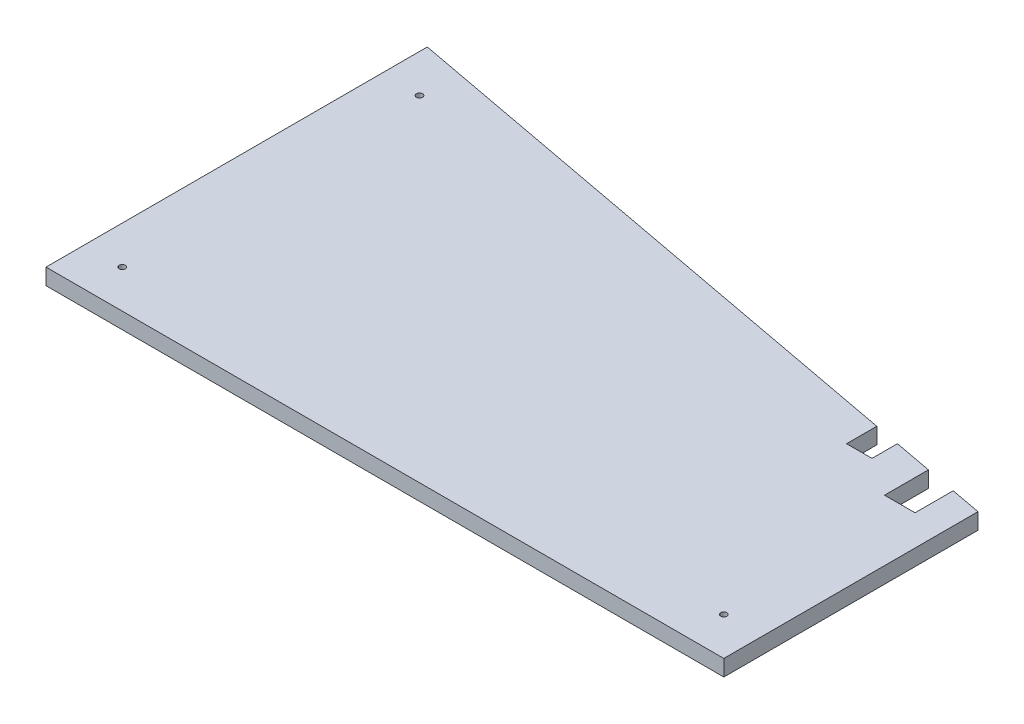
from build123d import *

# Parameters (mm, degrees)
BOSS_EXTRUDE1_DEPTH = 6.35
SKETCH3_R           = 1.225
CUT_EXTRUDE1_DEPTH  = 307.010694258


with BuildPart() as part:
    # Sketch2 → Boss-Extrude1 (new body)
    with BuildSketch(Plane(origin=(0, 0, 0), x_dir=(1, 0, 0), z_dir=(0, 1, 0))):
        Polygon((0, 0), (266.65, 0), (266.65, 100), (254.65, 102.250140634), (254.65, 87.250140634), (242.650050871, 87.215199066), (242.650050871, 104.500271729), (227.650050871, 107.312947521), (227.650050871, 97.312947521), (217.650050871, 97.283829424), (217.650050871, 109.188064716), (0, 150), align=None)
    extrude(amount=BOSS_EXTRUDE1_DEPTH)

    # Sketch3 → Cut-Extrude1 (cut, through all)
    with BuildSketch(Plane(origin=(0, 6.35, 0), x_dir=(1, 0, 0), z_dir=(0, 1, 0))):
        with Locations((15, 131.925897501)):
            Circle(SKETCH3_R)
        with Locations((15, 15)):
            Circle(SKETCH3_R)
        with Locations((251.65, 15)):
            Circle(SKETCH3_R)
    extrude(amount=-CUT_EXTRUDE1_DEPTH, mode=Mode.SUBTRACT)


solid = part.part
